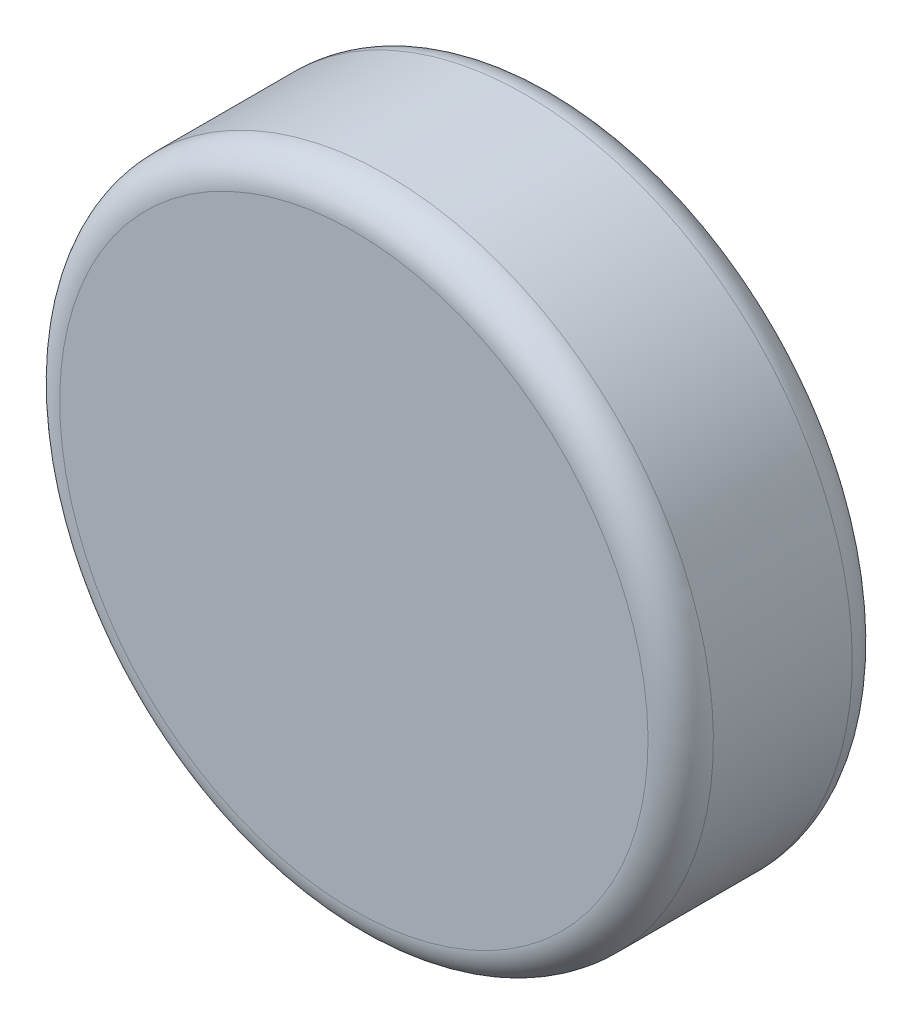
from build123d import *

# Parameters (mm, degrees)
SKETCH1_R           = 4
BOSS_EXTRUDE1_DEPTH = 2.5
FILLET1_R           = 0.4


with BuildPart() as part:
    # Sketch1 → Boss-Extrude1 (new body)
    with BuildSketch(Plane(origin=(0, 0, 15.395), x_dir=(-1, 0, 0), z_dir=(0, 0, -1))):
        with Locations((4.95, -15.400000468)):
            Circle(SKETCH1_R)
    extrude(amount=BOSS_EXTRUDE1_DEPTH)

    # Fillet1
    fillet1_edges = [part.edges().sort_by_distance(p)[0] for p in [
        (-0.95, -15.400000468, 15.395),
        (-0.95, -15.400000468, 12.895),
    ]]
    fillet(fillet1_edges, radius=FILLET1_R)


solid = part.part
